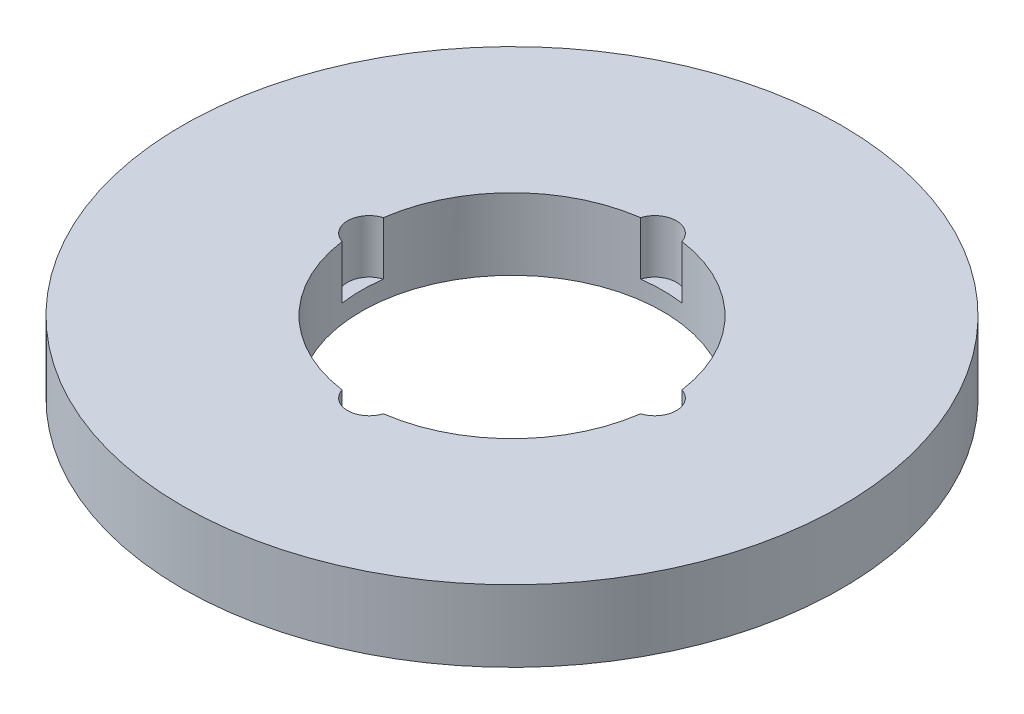
from build123d import *

# Parameters (mm, degrees)
SKETCH1_R           = 87.5
BOSS_EXTRUDE1_DEPTH = 19
SKETCH2_R           = 40
CUT_EXTRUDE1_DEPTH  = 126.193849689
SKETCH3_R           = 5.755389106
CUT_EXTRUDE2_DEPTH  = 14.150464049
CIRPATTERN1_COUNT   = 4


with BuildPart() as part:
    # Sketch1 → Boss-Extrude1 (new body)
    with BuildSketch(Plane(origin=(0, 0, 0), x_dir=(1, 0, 0), z_dir=(0, 1, 0))):
        Circle(SKETCH1_R)
    extrude(amount=BOSS_EXTRUDE1_DEPTH)

    # Sketch2 → Cut-Extrude1 (cut, through all)
    with BuildSketch(Plane(origin=(0, 0, 0), x_dir=(1, 0, 0), z_dir=(0, 1, 0))):
        Circle(SKETCH2_R)
    extrude(amount=CUT_EXTRUDE1_DEPTH, mode=Mode.SUBTRACT)

    # Sketch3 → Cut-Extrude2 (cut)
    with BuildSketch(Plane(origin=(0, 19, 0), x_dir=(1, 0, 0), z_dir=(0, 1, 0))):
        with Locations((-37.895433035, 0)):
            Circle(SKETCH3_R)
    cut_extrude2 = extrude(amount=-CUT_EXTRUDE2_DEPTH, mode=Mode.SUBTRACT)

    # CirPattern1: Cut-Extrude2 ×4 about axis
    cirpattern1_axis = Axis((0, 0, 0), (0, 1, 0))
    for i in range(1, CIRPATTERN1_COUNT):
        add(cut_extrude2.rotate(cirpattern1_axis, i * 360 / CIRPATTERN1_COUNT), mode=Mode.SUBTRACT)


solid = part.part
